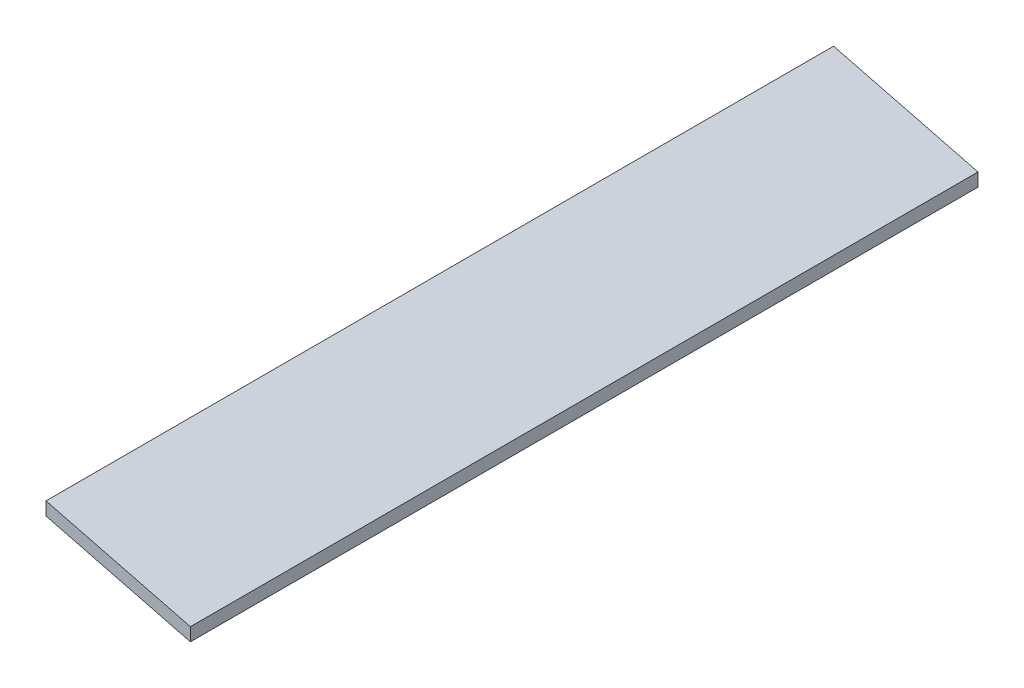
from build123d import *

# Parameters (mm, degrees)
BOSS_EXTRU_1_DEPTH = 600


with BuildPart() as part:
    # Esquisse1 → Boss.-Extru.1 (new body)
    with BuildSketch(Plane.XY):
        Polygon((120, 155), (10, 183), (10, 173), (120, 145), align=None)
    extrude(amount=-BOSS_EXTRU_1_DEPTH)


solid = part.part
